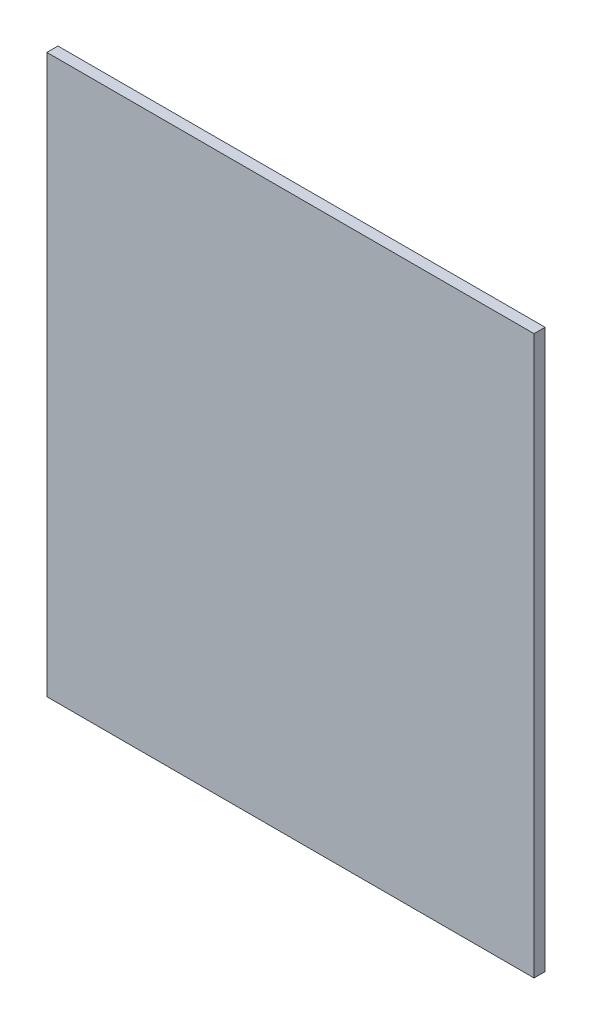
from build123d import *

# Parameters (mm, degrees)
ESQUISSE1_W        = 220
ESQUISSE1_H        = 252
BOSS_EXTRU_1_DEPTH = 5


with BuildPart() as part:
    # Esquisse1 → Boss.-Extru.1 (new body)
    with BuildSketch(Plane.XY):
        with Locations((240, -94.8)):
            Rectangle(ESQUISSE1_W, ESQUISSE1_H)
    extrude(amount=BOSS_EXTRU_1_DEPTH)


solid = part.part
